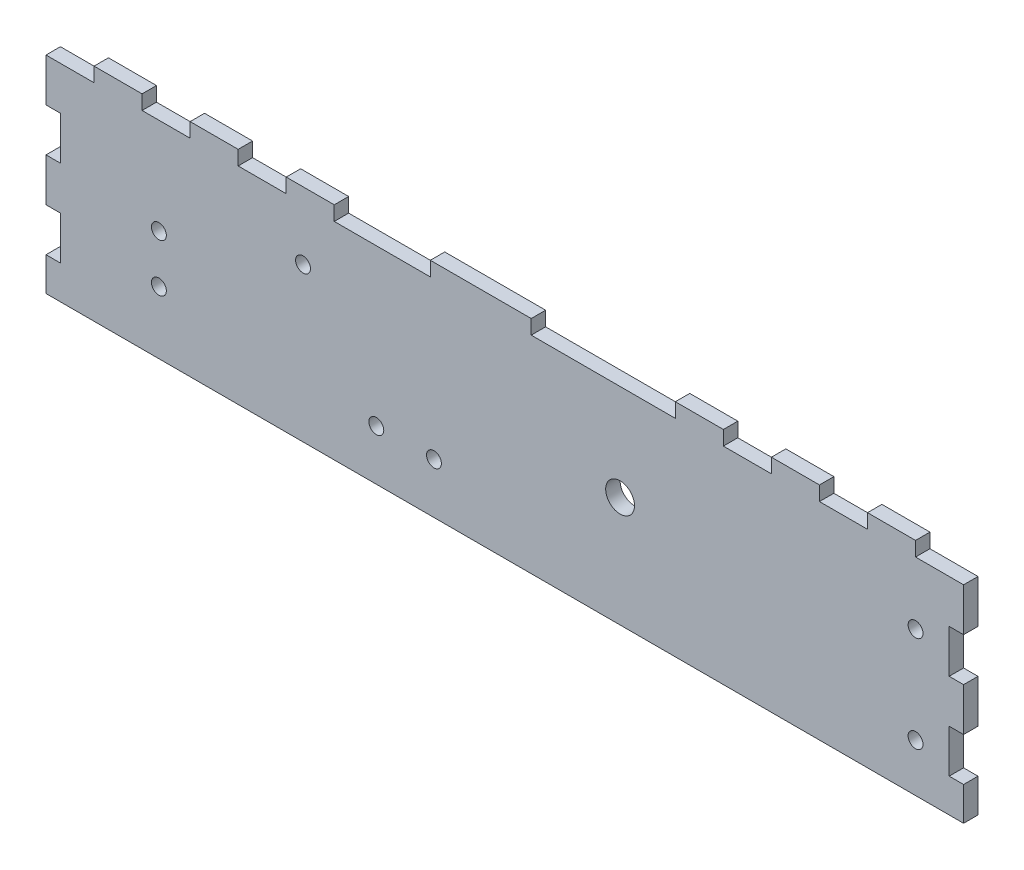
from build123d import *

# Parameters (mm, degrees)
SKETCH1_W           = 191
SKETCH1_H           = 46
SKETCH1_R           = 1.549999948
BOSS_EXTRUDE1_DEPTH = 3
CUT_EXTRUDE1_REACH  = 198.484
SKETCH4_W           = 10
SKETCH4_H           = 3
SKETCH4_W_2         = 20
SKETCH4_W_3         = 30
CUT_EXTRUDE2_REACH  = 198.484
SKETCH5_W           = 3
SKETCH5_H           = 9
CUT_EXTRUDE3_REACH  = 198.484
SKETCH6_W           = 3
SKETCH6_H           = 9
CUT_EXTRUDE4_REACH  = 198.484
SKETCH7_R           = 3
CUT_EXTRUDE5_REACH  = 198.484
SKETCH8_R           = 1.55


with BuildPart() as part:
    # Sketch1 → Boss-Extrude1 (new body)
    with BuildSketch(Plane.XY):
        with Locations((95.5, 23)):
            Rectangle(SKETCH1_W, SKETCH1_H)
        with Locations((181, 30)):
            Circle(SKETCH1_R, mode=Mode.SUBTRACT)
        with Locations((181, 10)):
            Circle(SKETCH1_R, mode=Mode.SUBTRACT)
    extrude(amount=BOSS_EXTRUDE1_DEPTH)

    # Sketch4 → Cut-Extrude1 (cut, up to next)
    with BuildSketch(Plane(origin=(0, 0, 0), x_dir=(-1, 0, 0), z_dir=(0, 0, -1)), mode=Mode.PRIVATE) as cut_extrude1_sk1:
        with Locations((-5, 44.5)):
            Rectangle(SKETCH4_W, SKETCH4_H)
    cut_extrude1_tool1 = extrude(cut_extrude1_sk1.sketch, amount=-CUT_EXTRUDE1_REACH, mode=Mode.PRIVATE) & part.part
    # Sketch4 → Cut-Extrude1 (cut, up to next)
    with BuildSketch(Plane(origin=(0, 0, 0), x_dir=(-1, 0, 0), z_dir=(0, 0, -1)), mode=Mode.PRIVATE) as cut_extrude1_sk2:
        with Locations((-25, 44.5)):
            Rectangle(SKETCH4_W, SKETCH4_H)
    cut_extrude1_tool2 = extrude(cut_extrude1_sk2.sketch, amount=-CUT_EXTRUDE1_REACH, mode=Mode.PRIVATE) & part.part
    # Sketch4 → Cut-Extrude1 (cut, up to next)
    with BuildSketch(Plane(origin=(0, 0, 0), x_dir=(-1, 0, 0), z_dir=(0, 0, -1)), mode=Mode.PRIVATE) as cut_extrude1_sk3:
        with Locations((-45, 44.5)):
            Rectangle(SKETCH4_W, SKETCH4_H)
    cut_extrude1_tool3 = extrude(cut_extrude1_sk3.sketch, amount=-CUT_EXTRUDE1_REACH, mode=Mode.PRIVATE) & part.part
    # Sketch4 → Cut-Extrude1 (cut, up to next)
    with BuildSketch(Plane(origin=(0, 0, 0), x_dir=(-1, 0, 0), z_dir=(0, 0, -1)), mode=Mode.PRIVATE) as cut_extrude1_sk4:
        with Locations((-70, 44.5)):
            Rectangle(SKETCH4_W_2, SKETCH4_H)
    cut_extrude1_tool4 = extrude(cut_extrude1_sk4.sketch, amount=-CUT_EXTRUDE1_REACH, mode=Mode.PRIVATE) & part.part
    # Sketch4 → Cut-Extrude1 (cut, up to next)
    with BuildSketch(Plane(origin=(0, 0, 0), x_dir=(-1, 0, 0), z_dir=(0, 0, -1)), mode=Mode.PRIVATE) as cut_extrude1_sk5:
        with Locations((-116, 44.5)):
            Rectangle(SKETCH4_W_3, SKETCH4_H)
    cut_extrude1_tool5 = extrude(cut_extrude1_sk5.sketch, amount=-CUT_EXTRUDE1_REACH, mode=Mode.PRIVATE) & part.part
    # Sketch4 → Cut-Extrude1 (cut, up to next)
    with BuildSketch(Plane(origin=(0, 0, 0), x_dir=(-1, 0, 0), z_dir=(0, 0, -1)), mode=Mode.PRIVATE) as cut_extrude1_sk6:
        with Locations((-146, 44.5)):
            Rectangle(SKETCH4_W, SKETCH4_H)
    cut_extrude1_tool6 = extrude(cut_extrude1_sk6.sketch, amount=-CUT_EXTRUDE1_REACH, mode=Mode.PRIVATE) & part.part
    # Sketch4 → Cut-Extrude1 (cut, up to next)
    with BuildSketch(Plane(origin=(0, 0, 0), x_dir=(-1, 0, 0), z_dir=(0, 0, -1)), mode=Mode.PRIVATE) as cut_extrude1_sk7:
        with Locations((-166, 44.5)):
            Rectangle(SKETCH4_W, SKETCH4_H)
    cut_extrude1_tool7 = extrude(cut_extrude1_sk7.sketch, amount=-CUT_EXTRUDE1_REACH, mode=Mode.PRIVATE) & part.part
    # Sketch4 → Cut-Extrude1 (cut, up to next)
    with BuildSketch(Plane(origin=(0, 0, 0), x_dir=(-1, 0, 0), z_dir=(0, 0, -1)), mode=Mode.PRIVATE) as cut_extrude1_sk8:
        with Locations((-186, 44.5)):
            Rectangle(SKETCH4_W, SKETCH4_H)
    cut_extrude1_tool8 = extrude(cut_extrude1_sk8.sketch, amount=-CUT_EXTRUDE1_REACH, mode=Mode.PRIVATE) & part.part
    add(cut_extrude1_tool1.solids().sort_by_distance((5, 44.5, 0))[0], mode=Mode.SUBTRACT)
    add(cut_extrude1_tool2.solids().sort_by_distance((25, 44.5, 0))[0], mode=Mode.SUBTRACT)
    add(cut_extrude1_tool3.solids().sort_by_distance((45, 44.5, 0))[0], mode=Mode.SUBTRACT)
    add(cut_extrude1_tool4.solids().sort_by_distance((70, 44.5, 0))[0], mode=Mode.SUBTRACT)
    add(cut_extrude1_tool5.solids().sort_by_distance((116, 44.5, 0))[0], mode=Mode.SUBTRACT)
    add(cut_extrude1_tool6.solids().sort_by_distance((146, 44.5, 0))[0], mode=Mode.SUBTRACT)
    add(cut_extrude1_tool7.solids().sort_by_distance((166, 44.5, 0))[0], mode=Mode.SUBTRACT)
    add(cut_extrude1_tool8.solids().sort_by_distance((186, 44.5, 0))[0], mode=Mode.SUBTRACT)

    # Sketch5 → Cut-Extrude2 (cut, up to next)
    with BuildSketch(Plane(origin=(0, 0, 0), x_dir=(-1, 0, 0), z_dir=(0, 0, -1)), mode=Mode.PRIVATE) as cut_extrude2_sk1:
        with Locations((-1.5, 29.5)):
            Rectangle(SKETCH5_W, SKETCH5_H)
    cut_extrude2_tool1 = extrude(cut_extrude2_sk1.sketch, amount=-CUT_EXTRUDE2_REACH, mode=Mode.PRIVATE) & part.part
    # Sketch5 → Cut-Extrude2 (cut, up to next)
    with BuildSketch(Plane(origin=(0, 0, 0), x_dir=(-1, 0, 0), z_dir=(0, 0, -1)), mode=Mode.PRIVATE) as cut_extrude2_sk2:
        with Locations((-1.5, 11.5)):
            Rectangle(SKETCH5_W, SKETCH5_H)
    cut_extrude2_tool2 = extrude(cut_extrude2_sk2.sketch, amount=-CUT_EXTRUDE2_REACH, mode=Mode.PRIVATE) & part.part
    add(cut_extrude2_tool1.solids().sort_by_distance((1.5, 29.5, 0))[0], mode=Mode.SUBTRACT)
    add(cut_extrude2_tool2.solids().sort_by_distance((1.5, 11.5, 0))[0], mode=Mode.SUBTRACT)

    # Sketch6 → Cut-Extrude3 (cut, up to next)
    with BuildSketch(Plane(origin=(0, 0, 0), x_dir=(-1, 0, 0), z_dir=(0, 0, -1)), mode=Mode.PRIVATE) as cut_extrude3_sk1:
        with Locations((-189.5, 29.5)):
            Rectangle(SKETCH6_W, SKETCH6_H)
    cut_extrude3_tool1 = extrude(cut_extrude3_sk1.sketch, amount=-CUT_EXTRUDE3_REACH, mode=Mode.PRIVATE) & part.part
    # Sketch6 → Cut-Extrude3 (cut, up to next)
    with BuildSketch(Plane(origin=(0, 0, 0), x_dir=(-1, 0, 0), z_dir=(0, 0, -1)), mode=Mode.PRIVATE) as cut_extrude3_sk2:
        with Locations((-189.5, 11.5)):
            Rectangle(SKETCH6_W, SKETCH6_H)
    cut_extrude3_tool2 = extrude(cut_extrude3_sk2.sketch, amount=-CUT_EXTRUDE3_REACH, mode=Mode.PRIVATE) & part.part
    add(cut_extrude3_tool1.solids().sort_by_distance((189.5, 29.5, 0))[0], mode=Mode.SUBTRACT)
    add(cut_extrude3_tool2.solids().sort_by_distance((189.5, 11.5, 0))[0], mode=Mode.SUBTRACT)

    # Sketch7 → Cut-Extrude4 (cut, up to next)
    with BuildSketch(Plane.XY.offset(3), mode=Mode.PRIVATE) as cut_extrude4_sk1:
        with Locations((119.5, 23)):
            Circle(SKETCH7_R)
    cut_extrude4_tool1 = extrude(cut_extrude4_sk1.sketch, amount=-CUT_EXTRUDE4_REACH, mode=Mode.PRIVATE) & part.part
    add(cut_extrude4_tool1.solids().sort_by_distance((119.5, 23, 3))[0], mode=Mode.SUBTRACT)

    # Sketch8 → Cut-Extrude5 (cut, up to next)
    with BuildSketch(Plane.XY.offset(3), mode=Mode.PRIVATE) as cut_extrude5_sk1:
        with Locations((23.5, 13)):
            Circle(SKETCH8_R)
    cut_extrude5_tool1 = extrude(cut_extrude5_sk1.sketch, amount=-CUT_EXTRUDE5_REACH, mode=Mode.PRIVATE) & part.part
    # Sketch8 → Cut-Extrude5 (cut, up to next)
    with BuildSketch(Plane.XY.offset(3), mode=Mode.PRIVATE) as cut_extrude5_sk2:
        with Locations((23.5, 23)):
            Circle(SKETCH8_R)
    cut_extrude5_tool2 = extrude(cut_extrude5_sk2.sketch, amount=-CUT_EXTRUDE5_REACH, mode=Mode.PRIVATE) & part.part
    # Sketch8 → Cut-Extrude5 (cut, up to next)
    with BuildSketch(Plane.XY.offset(3), mode=Mode.PRIVATE) as cut_extrude5_sk3:
        with Locations((53.5, 32)):
            Circle(SKETCH8_R)
    cut_extrude5_tool3 = extrude(cut_extrude5_sk3.sketch, amount=-CUT_EXTRUDE5_REACH, mode=Mode.PRIVATE) & part.part
    # Sketch8 → Cut-Extrude5 (cut, up to next)
    with BuildSketch(Plane.XY.offset(3), mode=Mode.PRIVATE) as cut_extrude5_sk4:
        with Locations((68.757359313, 10.5)):
            Circle(SKETCH8_R)
    cut_extrude5_tool4 = extrude(cut_extrude5_sk4.sketch, amount=-CUT_EXTRUDE5_REACH, mode=Mode.PRIVATE) & part.part
    # Sketch8 → Cut-Extrude5 (cut, up to next)
    with BuildSketch(Plane.XY.offset(3), mode=Mode.PRIVATE) as cut_extrude5_sk5:
        with Locations((80.757359313, 10.5)):
            Circle(SKETCH8_R)
    cut_extrude5_tool5 = extrude(cut_extrude5_sk5.sketch, amount=-CUT_EXTRUDE5_REACH, mode=Mode.PRIVATE) & part.part
    add(cut_extrude5_tool1.solids().sort_by_distance((23.5, 13, 3))[0], mode=Mode.SUBTRACT)
    add(cut_extrude5_tool2.solids().sort_by_distance((23.5, 23, 3))[0], mode=Mode.SUBTRACT)
    add(cut_extrude5_tool3.solids().sort_by_distance((53.5, 32, 3))[0], mode=Mode.SUBTRACT)
    add(cut_extrude5_tool4.solids().sort_by_distance((68.757359, 10.5, 3))[0], mode=Mode.SUBTRACT)
    add(cut_extrude5_tool5.solids().sort_by_distance((80.757359, 10.5, 3))[0], mode=Mode.SUBTRACT)


solid = part.part
